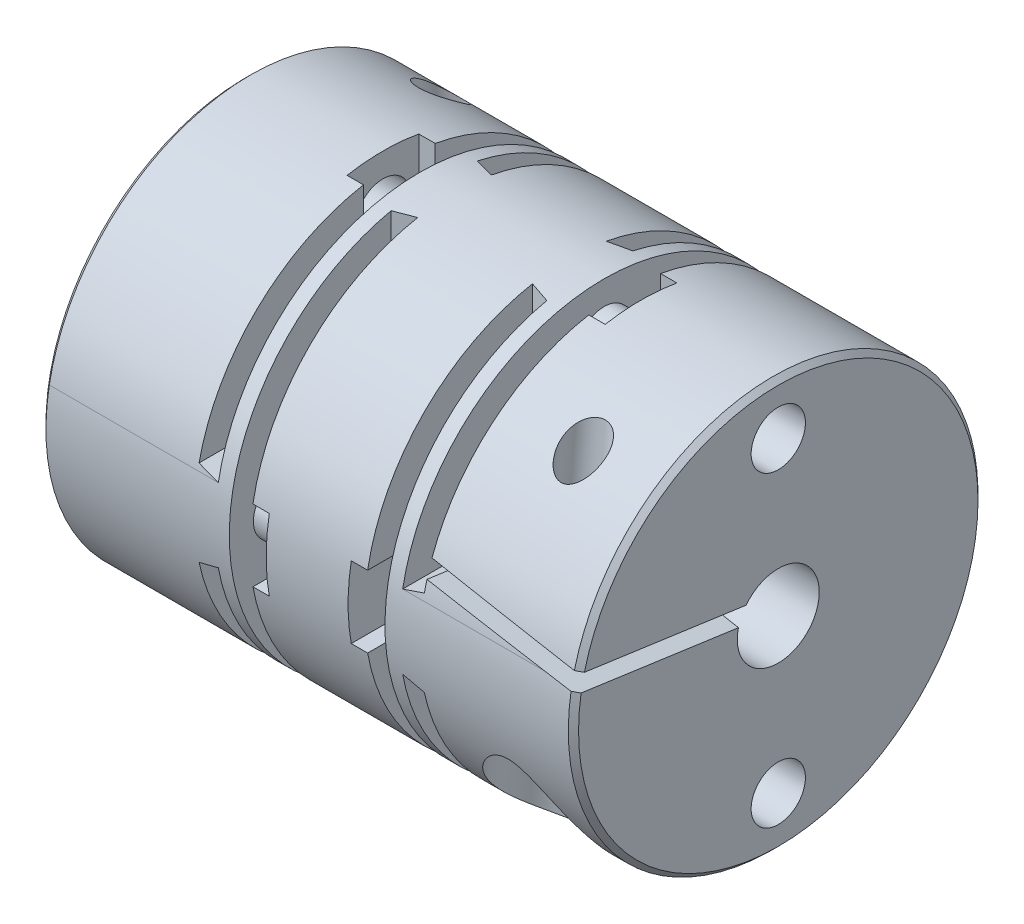
from build123d import *

# Parameters (mm, degrees)
CUT_EXTRUDE_1_DEPTH      = 10
CUT_EXTRUDE_2_DEPTH      = 10
CUT_EXTRUDE_3_DEPTH      = 10
CUT_EXTRUDE_3_DEPTH_BACK = 10
CUT_EXTRUDE_4_DEPTH      = 10
CUT_EXTRUDE_4_DEPTH_BACK = 10
CUT_EXTRUDE_5_DEPTH      = 10
CUT_EXTRUDE_5_DEPTH_BACK = 10
CUT_EXTRUDE_6_DEPTH      = 10
CUT_EXTRUDE_6_DEPTH_BACK = 10
CUT_EXTRUDE_7_DEPTH      = 0.8
CUT_EXTRUDE_8_DEPTH      = 0.8
CUT_EXTRUDE_START        = 0.8
CUT_EXTRUDE_9_DEPTH      = 0.8
CUT_EXTRUDE_10_DEPTH     = 0.8
CUT_EXTRUDE_11_DEPTH     = 0.8
CUT_EXTRUDE_12_DEPTH     = 0.8
CUT_EXTRUDE_13_DEPTH     = 0.8
CUT_EXTRUDE_14_DEPTH     = 0.8
SKETCH_18_R              = 1.325
EXTRUDE_1_DEPTH          = 0.8
SKETCH_19_R              = 1.325
EXTRUDE_2_DEPTH          = 0.8
SKETCH_20_R              = 1.325
EXTRUDE_3_DEPTH          = 0.8
SKETCH_21_R              = 1.325
EXTRUDE_4_DEPTH          = 0.8
EXTRUDE_START            = -0.8
SKETCH_22_R              = 1.325
EXTRUDE_5_DEPTH          = 0.8
SKETCH_23_R              = 1.325
EXTRUDE_6_DEPTH          = 0.8
EXTRUDE_START_2          = 0.8
SKETCH_24_R              = 1.325
EXTRUDE_7_DEPTH          = 0.8
SKETCH_25_R              = 1.325
EXTRUDE_8_DEPTH          = 0.8
CUT_EXTRUDE_START_2      = 7.5
SKETCH_26_R              = 1.325
CUT_EXTRUDE_15_DEPTH     = 7.5
SKETCH_27_R              = 1.325
CUT_EXTRUDE_16_DEPTH     = 7.5
SKETCH_28_R              = 1.325
CUT_EXTRUDE_17_DEPTH     = 7.5
SKETCH_29_R              = 1.325
CUT_EXTRUDE_18_DEPTH     = 7.5


with BuildPart() as part:
    # 草图1 → 旋转1 (revolve)
    with BuildSketch(Plane.XY):
        Polygon((0, 2), (7.5, 2), (7.5, 4.05), (18.5, 4.05), (18.5, 2), (26, 2), (26, 9.75), (25.75, 10), (0.25, 10), (0, 9.75), align=None)
    revolve(axis=Axis((26, 0, 0), (-1, 0, 0)))

    # 草图2 → 切除-拉伸1 (cut)
    with BuildSketch(Plane(origin=(0, 0, 0), x_dir=(1, 0, 0), z_dir=(0, -0.13917310096006544, 0.9902680687415704))):
        Polygon((-1.111338481, 0.986714455), (-1, 0.1945), (8.159979636, 1.481851184), (8.048641155, 2.274065639), align=None)
    extrude(amount=-CUT_EXTRUDE_1_DEPTH, mode=Mode.SUBTRACT)

    # 草图3 → 切除-拉伸2 (cut)
    with BuildSketch(Plane(origin=(0, 0, 0), x_dir=(1, 0, 0), z_dir=(0, 0.13917310096006544, 0.9902680687415704))):
        Polygon((17.830288433, 1.342678083), (26, 0.1945), (26.111338481, 0.986714455), (17.941626914, 2.134892538), align=None)
    extrude(amount=CUT_EXTRUDE_2_DEPTH, mode=Mode.SUBTRACT)

    # 草图4 → 切除-旋转1 (revolve, cut)
    with BuildSketch(Plane(origin=(3.7, 0, 0), x_dir=(0, 0, -1), z_dir=(1, 0, 0))):
        Polygon((7.346822965, -9.395434653), (4.682002148, -9.628576265), (4.071911948, -2.655213378), (5.491489393, -2.531016445), (5.712840379, -2.267220613), (4.601038146, 10.440737054), (5.60370811, 10.528459309), align=None)
    revolve(axis=Axis((3.7, 10.528459309, -5.60370811), (0, -0.9961946980917455, -0.08715574274765822)), mode=Mode.SUBTRACT)

    # 草图5 → 切除-旋转2 (revolve, cut)
    with BuildSketch(Plane(origin=(22.3, 0, 0), x_dir=(0, 0, -1), z_dir=(1, 0, 0))):
        Polygon((-5.60370811, 10.528459309), (-4.601038146, 10.440737054), (-5.712840379, -2.267220613), (-5.491489393, -2.531016445), (-4.071911948, -2.655213378), (-4.682002148, -9.628576265), (-7.346822965, -9.395434653), align=None)
    revolve(axis=Axis((22.3, -9.395434653, 7.346822965), (0, 0.9961946980917455, -0.08715574274765814)), mode=Mode.SUBTRACT)

    # 草图6 → 切除-拉伸3 (cut, two sides: drawn at the far end of the back side and taken through both)
    with BuildSketch(Plane.XY.offset(-CUT_EXTRUDE_3_DEPTH_BACK)):
        Polygon((7.5, 10.5), (7.5, 2.1), (8.5, 1.8), (8.5, 10), (17.5, 10), (17.5, 1.8), (18.5, 2.1), (18.5, 10.5), align=None)
    extrude(amount=CUT_EXTRUDE_3_DEPTH + CUT_EXTRUDE_3_DEPTH_BACK, mode=Mode.SUBTRACT)

    # 草图7 → 切除-拉伸4 (cut, two sides: drawn at the far end of the back side and taken through both)
    with BuildSketch(Plane.XY.offset(-CUT_EXTRUDE_4_DEPTH_BACK)):
        Polygon((7.5, -10.5), (18.5, -10.5), (18.5, -2.1), (17.5, -1.8), (17.5, -10), (8.5, -10), (8.5, -1.8), (7.5, -2.1), align=None)
    extrude(amount=CUT_EXTRUDE_4_DEPTH + CUT_EXTRUDE_4_DEPTH_BACK, mode=Mode.SUBTRACT)

    # 草图8 → 切除-拉伸5 (cut, two sides: drawn at the far end of the back side and taken through both)
    with BuildSketch(Plane(origin=(0, 0, 0), x_dir=(1, 0, 0), z_dir=(0, 1, 0)).offset(-CUT_EXTRUDE_5_DEPTH_BACK)):
        Polygon((9.2, 10.5), (9.2, 2.1), (10.2, 1.8), (10.2, 10), (15.8, 10), (15.8, 1.8), (16.8, 2.1), (16.8, 10.5), align=None)
    extrude(amount=CUT_EXTRUDE_5_DEPTH + CUT_EXTRUDE_5_DEPTH_BACK, mode=Mode.SUBTRACT)

    # 草图9 → 切除-拉伸6 (cut, two sides: drawn at the far end of the back side and taken through both)
    with BuildSketch(Plane(origin=(0, 0, 0), x_dir=(1, 0, 0), z_dir=(0, 1, 0)).offset(-CUT_EXTRUDE_6_DEPTH_BACK)):
        Polygon((9.2, -10.5), (16.8, -10.5), (16.8, -2.1), (15.8, -1.8), (15.8, -10), (10.2, -10), (10.2, -1.8), (9.2, -2.1), align=None)
    extrude(amount=CUT_EXTRUDE_6_DEPTH + CUT_EXTRUDE_6_DEPTH_BACK, mode=Mode.SUBTRACT)

    # 草图10 → 切除-拉伸7 (cut)
    with BuildSketch(Plane(origin=(15.8, 0, 0), x_dir=(0, 0, -1), z_dir=(1, 0, 0))):
        with BuildLine():
            Line((-10, -1.75), (-7.5, -1.75))
            ThreePointArc((-7.5, -1.75), (-5.75, 0), (-7.5, 1.75))
            Line((-7.5, 1.75), (-10, 1.75))
            Line((-10, 1.75), (-10, -1.75))
        make_face()
    extrude(amount=-CUT_EXTRUDE_7_DEPTH, mode=Mode.SUBTRACT)

    # 草图11 → 切除-拉伸8 (cut)
    with BuildSketch(Plane(origin=(15.8, 0, 0), x_dir=(0, 0, -1), z_dir=(1, 0, 0))):
        with BuildLine():
            Line((7.5, -1.75), (10, -1.75))
            Line((10, -1.75), (10, 1.75))
            Line((10, 1.75), (7.5, 1.75))
            ThreePointArc((7.5, 1.75), (5.75, 0), (7.5, -1.75))
        make_face()
    extrude(amount=-CUT_EXTRUDE_8_DEPTH, mode=Mode.SUBTRACT)

    # 草图12 → 切除-拉伸9 (cut)
    with BuildSketch(Plane(origin=(10.2, 0, 0), x_dir=(0, 0, -1), z_dir=(1, 0, 0)).offset(CUT_EXTRUDE_START)):
        with BuildLine():
            Line((-10, -1.75), (-7.5, -1.75))
            ThreePointArc((-7.5, -1.75), (-5.75, 0), (-7.5, 1.75))
            Line((-7.5, 1.75), (-10, 1.75))
            Line((-10, 1.75), (-10, -1.75))
        make_face()
    extrude(amount=-CUT_EXTRUDE_9_DEPTH, mode=Mode.SUBTRACT)

    # 草图13 → 切除-拉伸10 (cut)
    with BuildSketch(Plane(origin=(10.2, 0, 0), x_dir=(0, 0, -1), z_dir=(1, 0, 0)).offset(CUT_EXTRUDE_START)):
        with BuildLine():
            Line((7.5, -1.75), (10, -1.75))
            Line((10, -1.75), (10, 1.75))
            Line((10, 1.75), (7.5, 1.75))
            ThreePointArc((7.5, 1.75), (5.75, 0), (7.5, -1.75))
        make_face()
    extrude(amount=-CUT_EXTRUDE_10_DEPTH, mode=Mode.SUBTRACT)

    # 草图14 → 切除-拉伸11 (cut)
    with BuildSketch(Plane(origin=(7.5, 0, 0), x_dir=(0, 0, -1), z_dir=(1, 0, 0))):
        with BuildLine():
            Line((1.75, 7.5), (1.75, 10))
            Line((1.75, 10), (-1.75, 10))
            Line((-1.75, 10), (-1.75, 7.5))
            ThreePointArc((-1.75, 7.5), (0, 5.75), (1.75, 7.5))
        make_face()
    extrude(amount=-CUT_EXTRUDE_11_DEPTH, mode=Mode.SUBTRACT)

    # 草图15 → 切除-拉伸12 (cut)
    with BuildSketch(Plane(origin=(7.5, 0, 0), x_dir=(0, 0, -1), z_dir=(1, 0, 0))):
        with BuildLine():
            Line((-1.75, -7.5), (-1.75, -10))
            Line((-1.75, -10), (1.75, -10))
            Line((1.75, -10), (1.75, -7.5))
            ThreePointArc((1.75, -7.5), (0, -5.75), (-1.75, -7.5))
        make_face()
    extrude(amount=-CUT_EXTRUDE_12_DEPTH, mode=Mode.SUBTRACT)

    # 草图16 → 切除-拉伸13 (cut)
    with BuildSketch(Plane(origin=(18.5, 0, 0), x_dir=(0, 0, -1), z_dir=(1, 0, 0)).offset(CUT_EXTRUDE_START)):
        with BuildLine():
            Line((1.75, 7.5), (1.75, 10))
            Line((1.75, 10), (-1.75, 10))
            Line((-1.75, 10), (-1.75, 7.5))
            ThreePointArc((-1.75, 7.5), (0, 5.75), (1.75, 7.5))
        make_face()
    extrude(amount=-CUT_EXTRUDE_13_DEPTH, mode=Mode.SUBTRACT)

    # 草图17 → 切除-拉伸14 (cut)
    with BuildSketch(Plane(origin=(18.5, 0, 0), x_dir=(0, 0, -1), z_dir=(1, 0, 0)).offset(CUT_EXTRUDE_START)):
        with BuildLine():
            Line((-1.75, -7.5), (-1.75, -10))
            Line((-1.75, -10), (1.75, -10))
            Line((1.75, -10), (1.75, -7.5))
            ThreePointArc((1.75, -7.5), (0, -5.75), (-1.75, -7.5))
        make_face()
    extrude(amount=-CUT_EXTRUDE_14_DEPTH, mode=Mode.SUBTRACT)

    # 草图18 → 凸台-拉伸1 (add)
    with BuildSketch(Plane(origin=(9.2, 0, 0), x_dir=(0, 0, -1), z_dir=(1, 0, 0))):
        with Locations((-7.5, 0)):
            Circle(SKETCH_18_R)
    extrude(amount=EXTRUDE_1_DEPTH)

    # 草图19 → 凸台-拉伸2 (add)
    with BuildSketch(Plane(origin=(9.2, 0, 0), x_dir=(0, 0, -1), z_dir=(1, 0, 0))):
        with Locations((7.5, 0)):
            Circle(SKETCH_19_R)
    extrude(amount=EXTRUDE_2_DEPTH)

    # 草图20 → 凸台-拉伸3 (add)
    with BuildSketch(Plane(origin=(8.5, 0, 0), x_dir=(0, 0, -1), z_dir=(1, 0, 0))):
        with Locations((0, 7.5)):
            Circle(SKETCH_20_R)
    extrude(amount=-EXTRUDE_3_DEPTH)

    # 草图21 → 凸台-拉伸4 (add)
    with BuildSketch(Plane(origin=(8.5, 0, 0), x_dir=(0, 0, -1), z_dir=(1, 0, 0))):
        with Locations((0, -7.5)):
            Circle(SKETCH_21_R)
    extrude(amount=-EXTRUDE_4_DEPTH)

    # 草图22 → 凸台-拉伸5 (add)
    with BuildSketch(Plane(origin=(16.8, 0, 0), x_dir=(0, 0, -1), z_dir=(1, 0, 0)).offset(EXTRUDE_START)):
        with Locations((-7.5, 0)):
            Circle(SKETCH_22_R)
    extrude(amount=EXTRUDE_5_DEPTH)

    # 草图23 → 凸台-拉伸6 (add)
    with BuildSketch(Plane(origin=(16.8, 0, 0), x_dir=(0, 0, -1), z_dir=(1, 0, 0)).offset(EXTRUDE_START)):
        with Locations((7.5, 0)):
            Circle(SKETCH_23_R)
    extrude(amount=EXTRUDE_6_DEPTH)

    # 草图24 → 凸台-拉伸7 (add)
    with BuildSketch(Plane(origin=(17.5, 0, 0), x_dir=(0, 0, -1), z_dir=(1, 0, 0)).offset(EXTRUDE_START_2)):
        with Locations((0, 7.5)):
            Circle(SKETCH_24_R)
    extrude(amount=-EXTRUDE_7_DEPTH)

    # 草图25 → 凸台-拉伸8 (add)
    with BuildSketch(Plane(origin=(17.5, 0, 0), x_dir=(0, 0, -1), z_dir=(1, 0, 0)).offset(EXTRUDE_START_2)):
        with Locations((0, -7.5)):
            Circle(SKETCH_25_R)
    extrude(amount=-EXTRUDE_8_DEPTH)

    # 草图26 → 切除-拉伸15 (cut)
    with BuildSketch(Plane(origin=(0, 0, 0), x_dir=(0, 0, -1), z_dir=(1, 0, 0)).offset(CUT_EXTRUDE_START_2)):
        with Locations((0, 7.5)):
            Circle(SKETCH_26_R)
    extrude(amount=-CUT_EXTRUDE_15_DEPTH, mode=Mode.SUBTRACT)

    # 草图27 → 切除-拉伸16 (cut)
    with BuildSketch(Plane(origin=(0, 0, 0), x_dir=(0, 0, -1), z_dir=(1, 0, 0)).offset(CUT_EXTRUDE_START_2)):
        with Locations((0, -7.5)):
            Circle(SKETCH_27_R)
    extrude(amount=-CUT_EXTRUDE_16_DEPTH, mode=Mode.SUBTRACT)

    # 草图28 → 切除-拉伸17 (cut)
    with BuildSketch(Plane(origin=(26, 0, 0), x_dir=(0, 0, -1), z_dir=(1, 0, 0))):
        with Locations((0, 7.5)):
            Circle(SKETCH_28_R)
    extrude(amount=-CUT_EXTRUDE_17_DEPTH, mode=Mode.SUBTRACT)

    # 草图29 → 切除-拉伸18 (cut)
    with BuildSketch(Plane(origin=(26, 0, 0), x_dir=(0, 0, -1), z_dir=(1, 0, 0))):
        with Locations((0, -7.5)):
            Circle(SKETCH_29_R)
    extrude(amount=-CUT_EXTRUDE_18_DEPTH, mode=Mode.SUBTRACT)


solid = part.part
